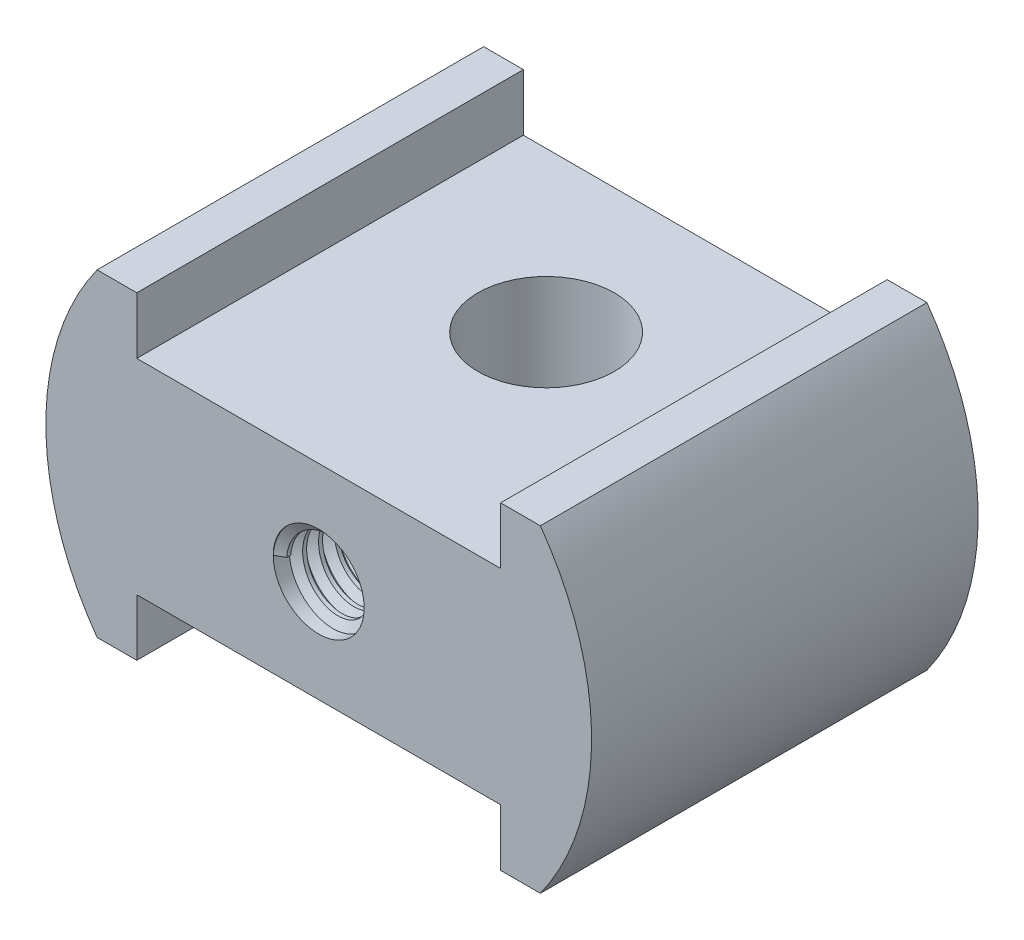
from build123d import *
from build123d.topology import SkipClean

# Parameters (mm, degrees)
BOSS_EXTRUDE1_DEPTH = 17
SKETCH2_R           = 3
CUT_EXTRUDE1_DEPTH  = 29.657459762
SKETCH3_R           = 2
CUT_EXTRUDE2_DEPTH  = 6.5
THREAD1_PITCH       = 0.7


with BuildPart() as part:
    # Sketch1 → Boss-Extrude1 (new body)
    with BuildSketch(Plane.XY):
        with BuildLine():
            Line((0, 0), (0, 2.5))
            Line((0, 2.5), (16, 2.5))
            Line((16, 2.5), (16, 0))
            Line((16, 0), (17.746794345, 0))
            ThreePointArc((17.746794345, 0), (20, 7), (17.746794345, 14))
            Line((17.746794345, 14), (16, 14))
            Line((16, 14), (16, 11.5))
            Line((16, 11.5), (0, 11.5))
            Line((0, 11.5), (0, 14))
            Line((0, 14), (-1.746794345, 14))
            ThreePointArc((-1.746794345, 14), (-4, 7), (-1.746794345, 0))
            Line((-1.746794345, 0), (0, 0))
        make_face()
    extrude(amount=BOSS_EXTRUDE1_DEPTH)

    # Sketch2 → Cut-Extrude1 (cut, through all)
    with BuildSketch(Plane.XZ.offset(-2.5)):
        with Locations(Location((8, 7, 0), (0, 0, 270))):
            Circle(SKETCH2_R)
    extrude(amount=-CUT_EXTRUDE1_DEPTH, mode=Mode.SUBTRACT)

    # Sketch3 → Cut-Extrude2 (cut)
    with BuildSketch(Plane.XY.offset(17)):
        with Locations((8, 7)):
            Circle(SKETCH3_R)
    extrude(amount=-CUT_EXTRUDE2_DEPTH, mode=Mode.SUBTRACT)

    # Thread1: the profile of Thread Profile1 profile screwed along a right-hand helix of 9.285714 turns, 6 arcs to a turn; built about Z, then put on its axis
    with SkipClean():  # the faces are left unmerged after this step: merging them gives an invalid solid
        thread1_z = Axis((0, 0, 0), (0, 0, 1))
        thread1_corners = [(2.0003, 0, -0.000173205), (2.0003, 0, 0.612673203), (1.621113887, 0, 0.393749999), (1.621113887, 0, 0.218749999)]
        with BuildLine(mode=Mode.PRIVATE) as thread1_profile:
            Line(thread1_corners[0], thread1_corners[1])
            Line(thread1_corners[1], thread1_corners[2])
            Line(thread1_corners[2], thread1_corners[3])
            Line(thread1_corners[3], thread1_corners[0])
        thread1_cap = Face(thread1_profile.wire())
        thread1_turn_angles = [0, 30, 60, 90, 120, 150, 180, 210, 240, 270, 300, 330, 360]
        thread1_turn_weights = [1, 0.8660254037844387, 1, 0.8660254037844387, 1, 0.8660254037844387, 1, 0.8660254037844387, 1, 0.8660254037844387, 1, 0.8660254037844387, 1]
        thread1_turn_rails = [Edge.make_bspline([Vector(p[0], p[1], 0).rotate(thread1_z, thread1_turn_angles[k]) / thread1_turn_weights[k] + Vector(0, 0, p[2] + THREAD1_PITCH * thread1_turn_angles[k] / 360) for k in range(13)], [0, 0, 0, 1, 1, 2, 2, 3, 3, 4, 4, 5, 5, 6, 6, 6], 2, thread1_turn_weights) for p in thread1_corners]
        thread1_turn_sides = [Face.make_surface_from_curves(thread1_turn_rails[p[0]], thread1_turn_rails[p[1]]) for p in [(0, 1), (1, 2), (2, 3), (3, 0)]]
        thread1_last_angles = [3240, 3270, 3300, 3321.428571429, 3342.857142857]
        thread1_last_weights = [1, 0.8660254037844387, 1, 0.9308737486442035, 1]
        thread1_last_rails = [Edge.make_bspline([Vector(p[0], p[1], 0).rotate(thread1_z, thread1_last_angles[k]) / thread1_last_weights[k] + Vector(0, 0, p[2] + THREAD1_PITCH * thread1_last_angles[k] / 360) for k in range(5)], [0, 0, 0, 1, 1, 2, 2, 2], 2, thread1_last_weights) for p in thread1_corners]
        thread1_last_sides = [Face.make_surface_from_curves(thread1_last_rails[p[0]], thread1_last_rails[p[1]]) for p in [(0, 1), (1, 2), (2, 3), (3, 0)]]
        thread1 = Plane(origin=(8, 7, 17), x_dir=(-1, 0, 0), z_dir=(0, 0, -1)) * Solid(Shell([*[p.moved(Location((0, 0, THREAD1_PITCH * i))) for i in range(9) for p in thread1_turn_sides], *thread1_last_sides, thread1_cap, thread1_cap.rotate(thread1_z, 3342.857142857).moved(Location((0, 0, THREAD1_PITCH * 3342.857142857 / 360)))]))
        add(thread1)


solid = part.part
